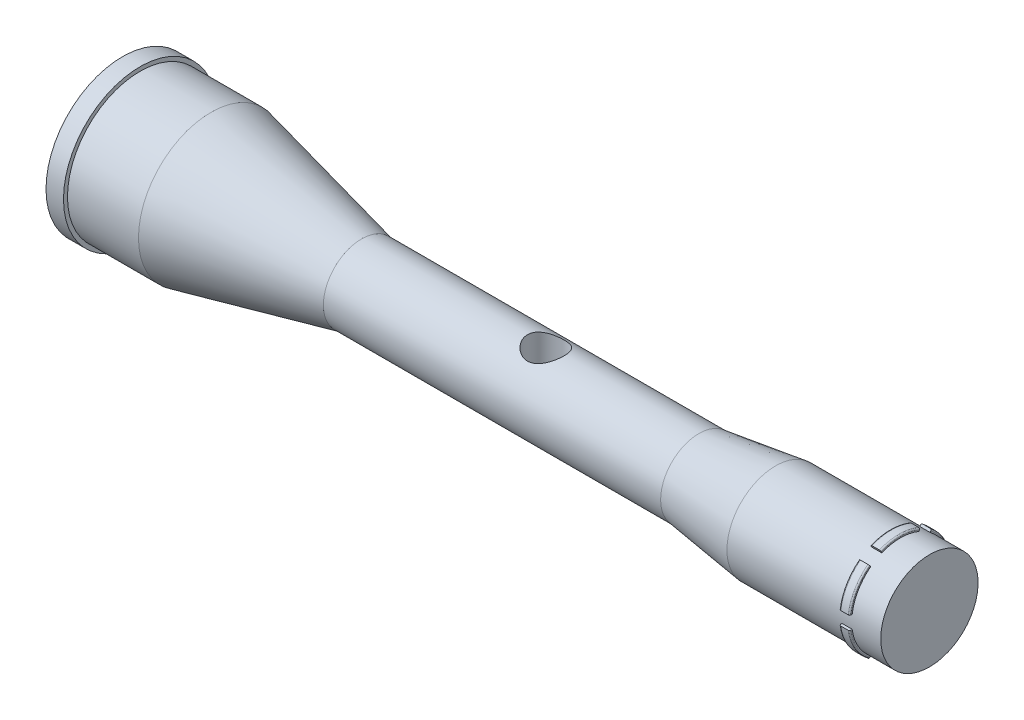
from build123d import *

# Parameters (mm, degrees)
BOSS_EXTRUDE1_DEPTH     = 3.73
BOSS_EXTRUDE1_2_DEPTH   = 3.73
BOSS_EXTRUDE1_3_DEPTH   = 3.73
BOSS_EXTRUDE1_4_DEPTH   = 3.73
BOSS_EXTRUDE1_5_DEPTH   = 3.73
BOSS_EXTRUDE1_6_DEPTH   = 3.73
FILLET1_R               = 0.5
FILLET2_R               = 0.5
FILLET3_R               = 0.5
FILLET4_R               = 0.5
FILLET5_R               = 0.5
FILLET6_R               = 0.5
CUT_EXTRUDE1_DEPTH      = 153.973408637
CUT_EXTRUDE1_DEPTH_BACK = 153.973408637
SKETCH3_R               = 6.702709332


with BuildPart() as part:
    # Sketch1 → Revolve1 (revolve)
    with BuildSketch(Plane(origin=(0, 0, 0), x_dir=(1, 0, 0), z_dir=(0, 1, 0))):
        Polygon((-147.75, 0), (-147.75, 28.025), (-141.35, 28.025), (-141.35, 26.56), (-115.35, 26.56), (-60.19, 14), (63.31, 14), (91.41, 17.82), (147.75, 17.82), (147.75, 0), align=None)
    revolve(axis=Axis((-147.75, 0, 0), (1, 0, 0)))

    # Sketch3 → Cut-Extrude1 (cut, two sides: drawn at the far end of the back side and taken through both)
    with BuildSketch(Plane(origin=(0, 0, 0), x_dir=(1, 0, 0), z_dir=(0, 1, 0)).offset(-CUT_EXTRUDE1_DEPTH_BACK)):
        with Locations((7.27, 0)):
            Circle(SKETCH3_R)
    extrude(amount=CUT_EXTRUDE1_DEPTH + CUT_EXTRUDE1_DEPTH_BACK, mode=Mode.SUBTRACT)


with BuildPart() as body_2:
    # Sketch2 → Boss-Extrude1 (new body)
    with BuildSketch(Plane(origin=(137.11, 0, 0), x_dir=(0, 0, -1), z_dir=(1, 0, 0))):
        with BuildLine():
            Line((-7.175314357, 17.322741235), (-6.819418765, 16.463533269))
            ThreePointArc((-6.819418765, 16.463533269), (0, 17.82), (6.819418765, 16.463533269))
            Line((6.819418765, 16.463533269), (7.175314357, 17.322741235))
            ThreePointArc((7.175314357, 17.322741235), (0, 18.75), (-7.175314357, 17.322741235))
        make_face()
    extrude(amount=-BOSS_EXTRUDE1_DEPTH)

    # Fillet2
    fillet2_edges = [body_2.edges().sort_by_distance(p)[0] for p in [
        (133.38, 18.75, 0),
        (137.11, 18.75, 0),
    ]]
    fillet(fillet2_edges, radius=FILLET2_R)


with BuildPart() as body_3:
    # Sketch2 → Boss-Extrude1 2 (new body)
    with BuildSketch(Plane(origin=(137.11, 0, 0), x_dir=(0, 0, -1), z_dir=(1, 0, 0))):
        with BuildLine():
            Line((11.414276794, 14.87537513), (10.848128665, 14.137556524))
            ThreePointArc((10.848128665, 14.137556524), (15.432572695, 8.91), (17.66754743, 2.325976745))
            Line((17.66754743, 2.325976745), (18.589591151, 2.447366104))
            ThreePointArc((18.589591151, 2.447366104), (16.237976321, 9.375), (11.414276794, 14.87537513))
        make_face()
    extrude(amount=-BOSS_EXTRUDE1_2_DEPTH)

    # Fillet1
    fillet1_edges = [body_3.edges().sort_by_distance(p)[0] for p in [
        (133.38, 9.375, -16.237976321),
        (137.11, 9.375, -16.237976321),
    ]]
    fillet(fillet1_edges, radius=FILLET1_R)


with BuildPart() as body_4:
    # Sketch2 → Boss-Extrude1 3 (new body)
    with BuildSketch(Plane(origin=(137.11, 0, 0), x_dir=(0, 0, -1), z_dir=(1, 0, 0))):
        with BuildLine():
            Line((18.589591151, -2.447366104), (17.66754743, -2.325976745))
            ThreePointArc((17.66754743, -2.325976745), (15.432572695, -8.91), (10.848128665, -14.137556524))
            Line((10.848128665, -14.137556524), (11.414276794, -14.87537513))
            ThreePointArc((11.414276794, -14.87537513), (16.237976321, -9.375), (18.589591151, -2.447366104))
        make_face()
    extrude(amount=-BOSS_EXTRUDE1_3_DEPTH)

    # Fillet6
    fillet6_edges = [body_4.edges().sort_by_distance(p)[0] for p in [
        (137.11, -9.375, -16.237976321),
        (133.38, -9.375, -16.237976321),
    ]]
    fillet(fillet6_edges, radius=FILLET6_R)


with BuildPart() as body_5:
    # Sketch2 → Boss-Extrude1 4 (new body)
    with BuildSketch(Plane(origin=(137.11, 0, 0), x_dir=(0, 0, -1), z_dir=(1, 0, 0))):
        with BuildLine():
            Line((7.175314357, -17.322741235), (6.819418765, -16.463533269))
            ThreePointArc((6.819418765, -16.463533269), (0, -17.82), (-6.819418765, -16.463533269))
            Line((-6.819418765, -16.463533269), (-7.175314357, -17.322741235))
            ThreePointArc((-7.175314357, -17.322741235), (0, -18.75), (7.175314357, -17.322741235))
        make_face()
    extrude(amount=-BOSS_EXTRUDE1_4_DEPTH)

    # Fillet5
    fillet5_edges = [body_5.edges().sort_by_distance(p)[0] for p in [
        (137.11, -18.75, 0),
        (133.38, -18.75, 0),
    ]]
    fillet(fillet5_edges, radius=FILLET5_R)


with BuildPart() as body_6:
    # Sketch2 → Boss-Extrude1 5 (new body)
    with BuildSketch(Plane(origin=(137.11, 0, 0), x_dir=(0, 0, -1), z_dir=(1, 0, 0))):
        with BuildLine():
            Line((-11.414276794, -14.87537513), (-10.848128665, -14.137556524))
            ThreePointArc((-10.848128665, -14.137556524), (-15.432572695, -8.91), (-17.66754743, -2.325976745))
            Line((-17.66754743, -2.325976745), (-18.589591151, -2.447366104))
            ThreePointArc((-18.589591151, -2.447366104), (-16.237976321, -9.375), (-11.414276794, -14.87537513))
        make_face()
    extrude(amount=-BOSS_EXTRUDE1_5_DEPTH)

    # Fillet4
    fillet4_edges = [body_6.edges().sort_by_distance(p)[0] for p in [
        (133.38, -9.375, 16.237976321),
        (137.11, -9.375, 16.237976321),
    ]]
    fillet(fillet4_edges, radius=FILLET4_R)


with BuildPart() as body_7:
    # Sketch2 → Boss-Extrude1 6 (new body)
    with BuildSketch(Plane(origin=(137.11, 0, 0), x_dir=(0, 0, -1), z_dir=(1, 0, 0))):
        with BuildLine():
            Line((-18.589591151, 2.447366104), (-17.66754743, 2.325976745))
            ThreePointArc((-17.66754743, 2.325976745), (-15.432572695, 8.91), (-10.848128665, 14.137556524))
            Line((-10.848128665, 14.137556524), (-11.414276794, 14.87537513))
            ThreePointArc((-11.414276794, 14.87537513), (-16.237976321, 9.375), (-18.589591151, 2.447366104))
        make_face()
    extrude(amount=-BOSS_EXTRUDE1_6_DEPTH)

    # Fillet3
    fillet3_edges = [body_7.edges().sort_by_distance(p)[0] for p in [
        (133.38, 9.375, 16.237976321),
        (137.11, 9.375, 16.237976321),
    ]]
    fillet(fillet3_edges, radius=FILLET3_R)


solid = Compound([part.part, body_2.part, body_3.part, body_4.part, body_5.part, body_6.part, body_7.part])
